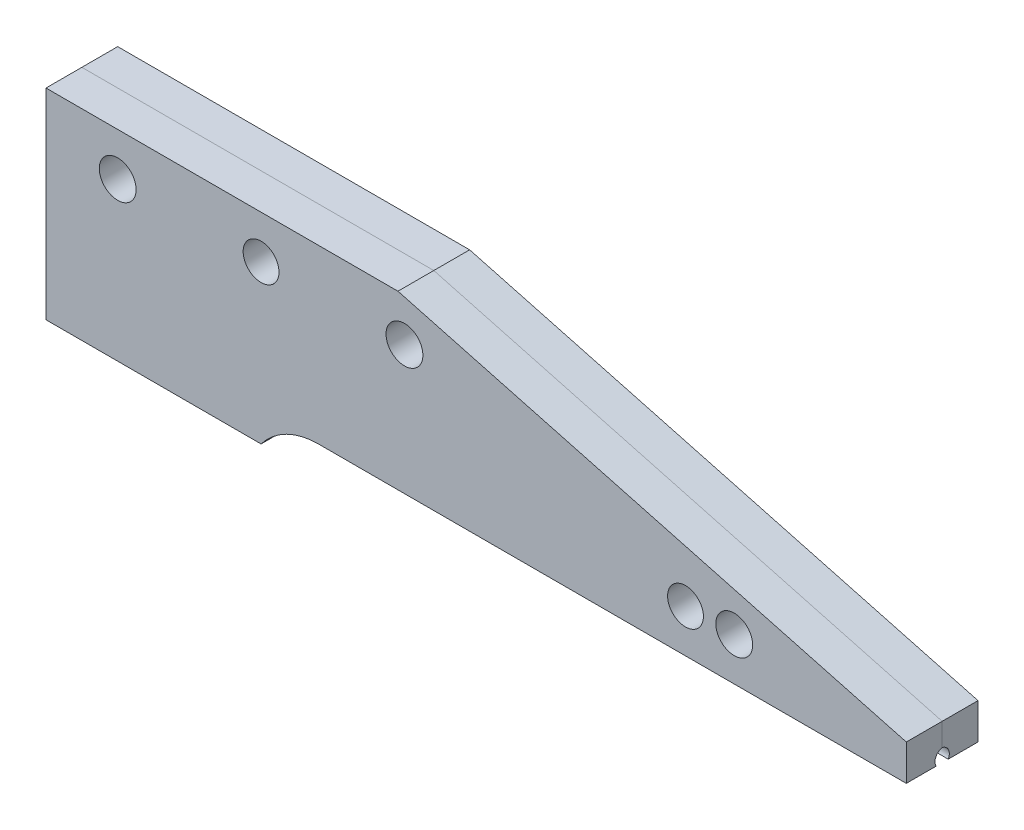
from build123d import *

# Parameters (mm, degrees)
BOSS_EXTRUDE1_DEPTH        = 3.175
SKETCH11_W                 = 19.05
SKETCH11_H                 = 3.175
BOSS_EXTRUDE2_DEPTH        = 2.54
FILLET2_R                  = 6.35
SKETCH3_R                  = 2
CUT_EXTRUDE2_DEPTH         = 17.272
SKETCH2_R                  = 0.79375
CUT_EXTRUDE1_DEPTH         = 78.773891667
SKETCH9_R                  = 1.5875
CUT_EXTRUDE3_DEPTH         = 53.34
F_4_CLEARANCE_HOLE1_D      = 3.2639
F_1_8_0_1250_DOWEL_HOLE1_D = 3.175


with BuildPart() as part:
    # Sketch1 → Boss-Extrude1 (new body)
    with BuildSketch(Plane.XY):
        Polygon((0, 0), (0, 15.24), (31.172807007, 15.24), (76.2, 3.175), (76.2, 0), align=None)
    extrude(amount=BOSS_EXTRUDE1_DEPTH)

    # Sketch11 → Boss-Extrude2 (add)
    with BuildSketch(Plane.XZ):
        with Locations((9.525, 1.5875)):
            Rectangle(SKETCH11_W, SKETCH11_H)
    extrude(amount=BOSS_EXTRUDE2_DEPTH)

    # Fillet2
    # the kernel refuses this fillet: 6.35 mm, written as the material it adds along each edge
    with BuildSketch(Plane(origin=(19.05, 0, 3.175), x_dir=(0, -1, 0), z_dir=(0, 0, -1))) as fillet2_piece_1:
        with BuildLine():
            CenterArc((6.35, -5.08), FILLET2_R, 126.869897646, 53.130102354)
            Line((0, -5.08), (-0.127, -5.08))
            Line((-0.127, -5.08), (-0.127, 0))
            Line((-0.127, 0), (0, 0.127))
            ThreePointArc((0, 0.127), (1.27, 0.127), (2.4638, 0.1016))
            Line((2.4638, 0.1016), (2.54, 0))
        make_face()
    extrude(amount=3.175)

    # Sketch3 → Cut-Extrude2 (cut)
    with BuildSketch(Plane.ZY):
        with Locations((3.175, 0.381)):
            Circle(SKETCH3_R)
    extrude(amount=-CUT_EXTRUDE2_DEPTH, mode=Mode.SUBTRACT)

    # Sketch2 → Cut-Extrude1 (cut, through all)
    with BuildSketch(Plane(origin=(76.2, 0, 0), x_dir=(0, 0, -1), z_dir=(1, 0, 0))):
        with Locations((-3.33375, 0.381)):
            Circle(SKETCH2_R)
    extrude(amount=-CUT_EXTRUDE1_DEPTH, mode=Mode.SUBTRACT)

    # Sketch9 → Cut-Extrude3 (cut)
    with BuildSketch(Plane.ZY):
        with Locations((3.175, 6.35)):
            Circle(SKETCH9_R)
    extrude(amount=-CUT_EXTRUDE3_DEPTH, mode=Mode.SUBTRACT)

    # Sketch10 → Cut-Revolve2 (revolve, cut)
    with BuildSketch(Plane.ZY.offset(-53.34)):
        with BuildLine():
            Line((3.175, 6.35), (3.175, 7.9375))
            ThreePointArc((3.175, 7.9375), (2.052467985, 7.472532015), (1.5875, 6.35))
            Line((1.5875, 6.35), (3.175, 6.35))
        make_face()
    revolve(axis=Axis((53.34, 6.35, 3.175), (0, 0, -1)), mode=Mode.SUBTRACT)

    # Sketch12 → Cut-Revolve3 (revolve, cut)
    with BuildSketch(Plane.ZY.offset(-17.272)):
        with BuildLine():
            Line((1.175, 0.381), (3.175, 0.381))
            Line((3.175, 0.381), (3.175, 2.381))
            ThreePointArc((3.175, 2.381), (1.760786438, 1.795213562), (1.175, 0.381))
        make_face()
    revolve(axis=Axis((17.272, 0.381, 1.175), (0, 0, 1)), mode=Mode.SUBTRACT)

    # #4 Clearance Hole1 (through all)
    with Locations(Plane(origin=(0, 0, 0), x_dir=(-1, 0, 0), z_dir=(0, 0, -1))):
        with Locations((-31.75, 11.43), (-6.35, 11.43), (-60.96, 3.81)):
            Hole(F_4_CLEARANCE_HOLE1_D / 2)

    # 1/8 (0.1250) Dowel Hole1 (through all)
    with Locations(Plane.XY.offset(3.175)):
        with Locations((19.05, 11.43), (56.642, 3.81)):
            Hole(F_1_8_0_1250_DOWEL_HOLE1_D / 2)


with BuildPart() as body_2:
    # Mirror1: mirrored copy
    add(part.part.mirror(Plane(origin=(0, 0, 3.175), x_dir=(1, 0, 0), z_dir=(0, 0, -1))))


solid = Compound([part.part, body_2.part])
